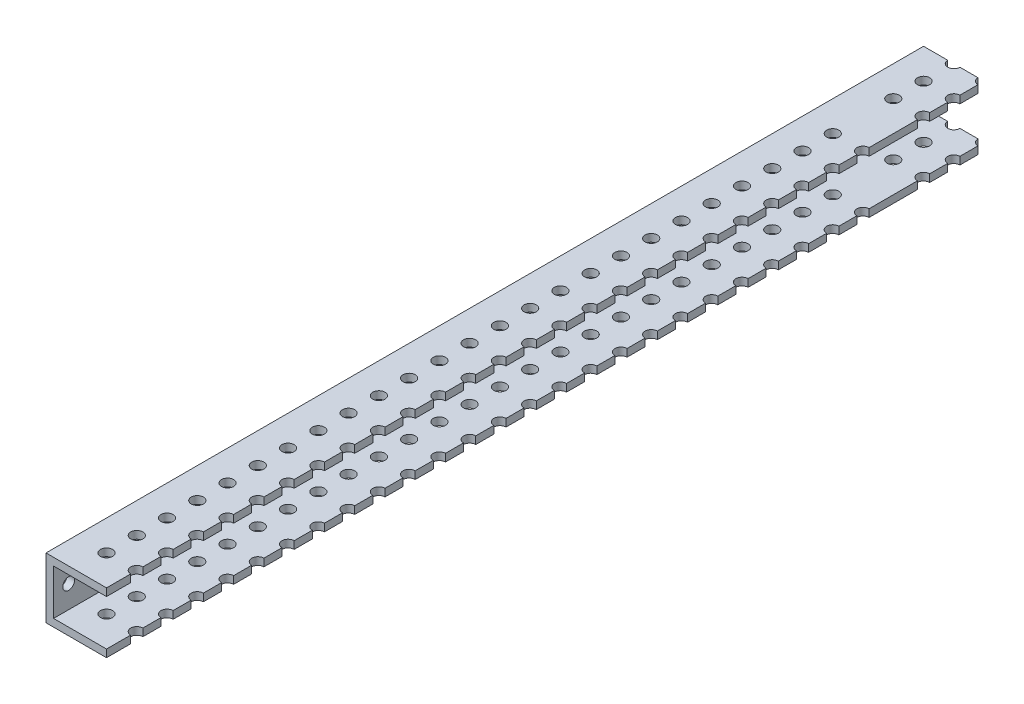
from build123d import *

# Parameters (mm, degrees)
SKETCH1_W           = 50.8
SKETCH1_H           = 25.4
SKETCH1_W_2         = 44.45
SKETCH1_H_2         = 19.05
BOSS_EXTRUDE1_DEPTH = 184.15
SKETCH2_R           = 2.5527
CUT_EXTRUDE1_DEPTH  = 188.620741124
SKETCH4_R           = 2.4892
CUT_EXTRUDE3_DEPTH  = 192.450130582
SKETCH6_W           = 25.4
SKETCH6_H           = 368.3
CUT_EXTRUDE5_DEPTH  = 188.620741124


with BuildPart() as part:
    # Sketch1 → Boss-Extrude1 (new, symmetric)
    with BuildSketch(Plane.XY):
        Rectangle(SKETCH1_W, SKETCH1_H)
        Rectangle(SKETCH1_W_2, SKETCH1_H_2, mode=Mode.SUBTRACT)
    extrude(amount=BOSS_EXTRUDE1_DEPTH, both=True)

    # Sketch2 → Cut-Extrude1 (cut, through all)
    with BuildSketch(Plane(origin=(0, 12.7, 0), x_dir=(1, 0, 0), z_dir=(0, 1, 0))):
        with Locations((0, -171.45)):
            Circle(SKETCH2_R)
        with Locations((12.7, -171.45)):
            Circle(SKETCH2_R)
        with Locations((-12.7, -171.45)):
            Circle(SKETCH2_R)
        with Locations((-12.7, -158.75)):
            Circle(SKETCH2_R)
        with Locations((0, -158.75)):
            Circle(SKETCH2_R)
        with Locations((12.7, -158.75)):
            Circle(SKETCH2_R)
        with Locations((-12.7, -146.05)):
            Circle(SKETCH2_R)
        with Locations((0, -146.05)):
            Circle(SKETCH2_R)
        with Locations((12.7, -146.05)):
            Circle(SKETCH2_R)
        with Locations((-12.7, -133.35)):
            Circle(SKETCH2_R)
        with Locations((0, -133.35)):
            Circle(SKETCH2_R)
        with Locations((12.7, -133.35)):
            Circle(SKETCH2_R)
        with Locations((-12.7, -120.65)):
            Circle(SKETCH2_R)
        with Locations((0, -120.65)):
            Circle(SKETCH2_R)
        with Locations((12.7, -120.65)):
            Circle(SKETCH2_R)
        with Locations((-12.7, -107.95)):
            Circle(SKETCH2_R)
        with Locations((0, -107.95)):
            Circle(SKETCH2_R)
        with Locations((12.7, -107.95)):
            Circle(SKETCH2_R)
        with Locations((-12.7, -95.25)):
            Circle(SKETCH2_R)
        with Locations((0, -95.25)):
            Circle(SKETCH2_R)
        with Locations((12.7, -95.25)):
            Circle(SKETCH2_R)
        with Locations((-12.7, -82.55)):
            Circle(SKETCH2_R)
        with Locations((0, -82.55)):
            Circle(SKETCH2_R)
        with Locations((12.7, -82.55)):
            Circle(SKETCH2_R)
        with Locations((-12.7, -69.85)):
            Circle(SKETCH2_R)
        with Locations((0, -69.85)):
            Circle(SKETCH2_R)
        with Locations((12.7, -69.85)):
            Circle(SKETCH2_R)
        with Locations((-12.7, -57.15)):
            Circle(SKETCH2_R)
        with Locations((0, -57.15)):
            Circle(SKETCH2_R)
        with Locations((12.7, -57.15)):
            Circle(SKETCH2_R)
        with Locations((-12.7, -44.45)):
            Circle(SKETCH2_R)
        with Locations((0, -44.45)):
            Circle(SKETCH2_R)
        with Locations((12.7, -44.45)):
            Circle(SKETCH2_R)
        with Locations((-12.7, -31.75)):
            Circle(SKETCH2_R)
        with Locations((0, -31.75)):
            Circle(SKETCH2_R)
        with Locations((12.7, -31.75)):
            Circle(SKETCH2_R)
        with Locations((-12.7, -19.05)):
            Circle(SKETCH2_R)
        with Locations((0, -19.05)):
            Circle(SKETCH2_R)
        with Locations((12.7, -19.05)):
            Circle(SKETCH2_R)
        with Locations((-12.7, -6.35)):
            Circle(SKETCH2_R)
        with Locations((0, -6.35)):
            Circle(SKETCH2_R)
        with Locations((12.7, -6.35)):
            Circle(SKETCH2_R)
        with Locations((-12.7, 6.35)):
            Circle(SKETCH2_R)
        with Locations((0, 6.35)):
            Circle(SKETCH2_R)
        with Locations((12.7, 6.35)):
            Circle(SKETCH2_R)
        with Locations((-12.7, 19.05)):
            Circle(SKETCH2_R)
        with Locations((0, 19.05)):
            Circle(SKETCH2_R)
        with Locations((12.7, 19.05)):
            Circle(SKETCH2_R)
        with Locations((-12.7, 31.75)):
            Circle(SKETCH2_R)
        with Locations((0, 31.75)):
            Circle(SKETCH2_R)
        with Locations((12.7, 31.75)):
            Circle(SKETCH2_R)
        with Locations((-12.7, 44.45)):
            Circle(SKETCH2_R)
        with Locations((0, 44.45)):
            Circle(SKETCH2_R)
        with Locations((12.7, 44.45)):
            Circle(SKETCH2_R)
        with Locations((-12.7, 57.15)):
            Circle(SKETCH2_R)
        with Locations((0, 57.15)):
            Circle(SKETCH2_R)
        with Locations((12.7, 57.15)):
            Circle(SKETCH2_R)
        with Locations((-12.7, 69.85)):
            Circle(SKETCH2_R)
        with Locations((0, 69.85)):
            Circle(SKETCH2_R)
        with Locations((12.7, 69.85)):
            Circle(SKETCH2_R)
        with Locations((-12.7, 82.55)):
            Circle(SKETCH2_R)
        with Locations((0, 82.55)):
            Circle(SKETCH2_R)
        with Locations((12.7, 82.55)):
            Circle(SKETCH2_R)
        with Locations((-12.7, 95.25)):
            Circle(SKETCH2_R)
        with Locations((0, 95.25)):
            Circle(SKETCH2_R)
        with Locations((12.7, 95.25)):
            Circle(SKETCH2_R)
        with Locations((-12.7, 107.95)):
            Circle(SKETCH2_R)
        with Locations((0, 107.95)):
            Circle(SKETCH2_R)
        with Locations((12.7, 107.95)):
            Circle(SKETCH2_R)
        with Locations((-12.7, 120.65)):
            Circle(SKETCH2_R)
        with Locations((0, 120.65)):
            Circle(SKETCH2_R)
        with Locations((12.7, 120.65)):
            Circle(SKETCH2_R)
        with Locations((-12.7, 133.35)):
            Circle(SKETCH2_R)
        with Locations((0, 133.35)):
            Circle(SKETCH2_R)
        with Locations((12.7, 133.35)):
            Circle(SKETCH2_R)
        with Locations((-12.7, 158.75)):
            Circle(SKETCH2_R)
        with Locations((0, 158.75)):
            Circle(SKETCH2_R)
        with Locations((12.7, 158.75)):
            Circle(SKETCH2_R)
        with Locations((-12.7, 171.45)):
            Circle(SKETCH2_R)
        with Locations((0, 171.45)):
            Circle(SKETCH2_R)
        with Locations((12.7, 171.45)):
            Circle(SKETCH2_R)
        with Locations((-12.7, 184.15)):
            Circle(SKETCH2_R)
        with Locations((0, 184.15)):
            Circle(SKETCH2_R)
        with Locations((12.7, 184.15)):
            Circle(SKETCH2_R)
        with Locations((-12.7, 196.85)):
            Circle(SKETCH2_R)
        with Locations((0, 196.85)):
            Circle(SKETCH2_R)
        with Locations((12.7, 196.85)):
            Circle(SKETCH2_R)
        with Locations((-12.7, 209.55)):
            Circle(SKETCH2_R)
        with Locations((0, 209.55)):
            Circle(SKETCH2_R)
        with Locations((12.7, 209.55)):
            Circle(SKETCH2_R)
        with Locations((-12.7, 222.25)):
            Circle(SKETCH2_R)
        with Locations((0, 222.25)):
            Circle(SKETCH2_R)
        with Locations((12.7, 222.25)):
            Circle(SKETCH2_R)
        with Locations((-12.7, 234.95)):
            Circle(SKETCH2_R)
        with Locations((0, 234.95)):
            Circle(SKETCH2_R)
        with Locations((12.7, 234.95)):
            Circle(SKETCH2_R)
        with Locations((-12.7, 247.65)):
            Circle(SKETCH2_R)
        with Locations((0, 247.65)):
            Circle(SKETCH2_R)
        with Locations((12.7, 247.65)):
            Circle(SKETCH2_R)
        with Locations((12.7, 260.35)):
            Circle(SKETCH2_R)
        with Locations((0, 260.35)):
            Circle(SKETCH2_R)
        with Locations((-12.7, 260.35)):
            Circle(SKETCH2_R)
        with Locations((12.7, 273.05)):
            Circle(SKETCH2_R)
        with Locations((0, 273.05)):
            Circle(SKETCH2_R)
        with Locations((-12.7, 273.05)):
            Circle(SKETCH2_R)
        with Locations((12.7, 285.75)):
            Circle(SKETCH2_R)
        with Locations((0, 285.75)):
            Circle(SKETCH2_R)
        with Locations((-12.7, 285.75)):
            Circle(SKETCH2_R)
        with Locations((12.7, 298.45)):
            Circle(SKETCH2_R)
        with Locations((0, 298.45)):
            Circle(SKETCH2_R)
        with Locations((-12.7, 298.45)):
            Circle(SKETCH2_R)
        with Locations((12.7, 311.15)):
            Circle(SKETCH2_R)
        with Locations((0, 311.15)):
            Circle(SKETCH2_R)
        with Locations((-12.7, 311.15)):
            Circle(SKETCH2_R)
        with Locations((12.7, 323.85)):
            Circle(SKETCH2_R)
        with Locations((0, 323.85)):
            Circle(SKETCH2_R)
        with Locations((-12.7, 323.85)):
            Circle(SKETCH2_R)
        with Locations((12.7, 336.55)):
            Circle(SKETCH2_R)
        with Locations((0, 336.55)):
            Circle(SKETCH2_R)
        with Locations((-12.7, 336.55)):
            Circle(SKETCH2_R)
        with Locations((12.7, 349.25)):
            Circle(SKETCH2_R)
        with Locations((0, 349.25)):
            Circle(SKETCH2_R)
        with Locations((-12.7, 349.25)):
            Circle(SKETCH2_R)
        with Locations((12.7, 361.95)):
            Circle(SKETCH2_R)
        with Locations((0, 361.95)):
            Circle(SKETCH2_R)
        with Locations((-12.7, 361.95)):
            Circle(SKETCH2_R)
        with Locations((12.7, 374.65)):
            Circle(SKETCH2_R)
        with Locations((0, 374.65)):
            Circle(SKETCH2_R)
        with Locations((-12.7, 374.65)):
            Circle(SKETCH2_R)
        with Locations((12.7, 387.35)):
            Circle(SKETCH2_R)
        with Locations((0, 387.35)):
            Circle(SKETCH2_R)
        with Locations((-12.7, 387.35)):
            Circle(SKETCH2_R)
        with Locations((12.7, 400.05)):
            Circle(SKETCH2_R)
        with Locations((0, 400.05)):
            Circle(SKETCH2_R)
        with Locations((-12.7, 400.05)):
            Circle(SKETCH2_R)
        with Locations((12.7, 412.75)):
            Circle(SKETCH2_R)
        with Locations((0, 412.75)):
            Circle(SKETCH2_R)
        with Locations((-12.7, 412.75)):
            Circle(SKETCH2_R)
    extrude(amount=-CUT_EXTRUDE1_DEPTH, mode=Mode.SUBTRACT)

    # Sketch4 → Cut-Extrude3 (cut, through all)
    with BuildSketch(Plane(origin=(25.4, 0, 0), x_dir=(0, 0, -1), z_dir=(1, 0, 0))):
        with Locations((-177.8, 0)):
            Circle(SKETCH4_R)
        with Locations((-165.1, 0)):
            Circle(SKETCH4_R)
        with Locations((-152.4, 0)):
            Circle(SKETCH4_R)
        with Locations((-139.7, 0)):
            Circle(SKETCH4_R)
        with Locations((-127, 0)):
            Circle(SKETCH4_R)
        with Locations((254, 0)):
            Circle(SKETCH4_R)
        with Locations((266.7, 0)):
            Circle(SKETCH4_R)
        with Locations((279.4, 0)):
            Circle(SKETCH4_R)
        with Locations((292.1, 0)):
            Circle(SKETCH4_R)
        with Locations((304.8, 0)):
            Circle(SKETCH4_R)
        with Locations((317.5, 0)):
            Circle(SKETCH4_R)
        with Locations((330.2, 0)):
            Circle(SKETCH4_R)
        with Locations((342.9, 0)):
            Circle(SKETCH4_R)
        with Locations((355.6, 0)):
            Circle(SKETCH4_R)
        with Locations((368.3, 0)):
            Circle(SKETCH4_R)
        with Locations((381, 0)):
            Circle(SKETCH4_R)
        with Locations((393.7, 0)):
            Circle(SKETCH4_R)
        with Locations((406.4, 0)):
            Circle(SKETCH4_R)
        with Locations((419.1, 0)):
            Circle(SKETCH4_R)
        with Locations((-114.3, 0)):
            Circle(SKETCH4_R)
        with Locations((-101.6, 0)):
            Circle(SKETCH4_R)
        with Locations((-88.9, 0)):
            Circle(SKETCH4_R)
        with Locations((-76.2, 0)):
            Circle(SKETCH4_R)
        with Locations((-63.5, 0)):
            Circle(SKETCH4_R)
        with Locations((-50.8, 0)):
            Circle(SKETCH4_R)
        with Locations((-38.1, 0)):
            Circle(SKETCH4_R)
        with Locations((-25.4, 0)):
            Circle(SKETCH4_R)
        with Locations((-12.7, 0)):
            Circle(SKETCH4_R)
        Circle(SKETCH4_R)
        with Locations((12.7, 0)):
            Circle(SKETCH4_R)
        with Locations((25.4, 0)):
            Circle(SKETCH4_R)
        with Locations((38.1, 0)):
            Circle(SKETCH4_R)
        with Locations((50.8, 0)):
            Circle(SKETCH4_R)
        with Locations((63.5, 0)):
            Circle(SKETCH4_R)
        with Locations((76.2, 0)):
            Circle(SKETCH4_R)
        with Locations((88.9, 0)):
            Circle(SKETCH4_R)
        with Locations((101.6, 0)):
            Circle(SKETCH4_R)
        with Locations((114.3, 0)):
            Circle(SKETCH4_R)
        with Locations((127, 0)):
            Circle(SKETCH4_R)
        with Locations((139.7, 0)):
            Circle(SKETCH4_R)
        with Locations((152.4, 0)):
            Circle(SKETCH4_R)
        with Locations((165.1, 0)):
            Circle(SKETCH4_R)
        with Locations((177.8, 0)):
            Circle(SKETCH4_R)
        with Locations((190.5, 0)):
            Circle(SKETCH4_R)
        with Locations((203.2, 0)):
            Circle(SKETCH4_R)
        with Locations((215.9, 0)):
            Circle(SKETCH4_R)
        with Locations((228.6, 0)):
            Circle(SKETCH4_R)
        with Locations((241.3, 0)):
            Circle(SKETCH4_R)
    extrude(amount=-CUT_EXTRUDE3_DEPTH, mode=Mode.SUBTRACT)

    # Sketch6 → Cut-Extrude5 (cut, through all)
    with BuildSketch(Plane(origin=(0, 12.7, 0), x_dir=(1, 0, 0), z_dir=(0, 1, 0))):
        with Locations((12.7, 0)):
            Rectangle(SKETCH6_W, SKETCH6_H)
    extrude(amount=-CUT_EXTRUDE5_DEPTH, mode=Mode.SUBTRACT)


solid = part.part
